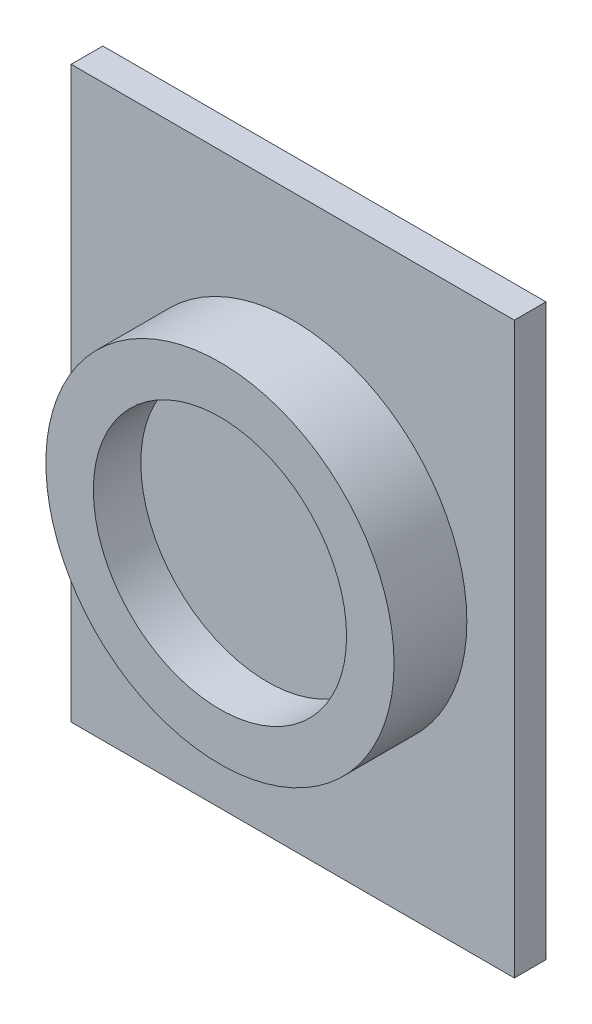
from build123d import *

# Parameters (mm, degrees)
CROQUIS1_W              = 140
CROQUIS1_H              = 180
SALIENTE_EXTRUIR1_DEPTH = 10
CROQUIS2_R              = 55
SALIENTE_EXTRUIR2_DEPTH = 8
CROQUIS3_R              = 55
CROQUIS3_R_2            = 40
SALIENTE_EXTRUIR3_DEPTH = 15


with BuildPart() as part:
    # Croquis1 → Saliente-Extruir1 (new body)
    with BuildSketch(Plane.XY):
        with Locations((70, 90)):
            Rectangle(CROQUIS1_W, CROQUIS1_H)
    extrude(amount=SALIENTE_EXTRUIR1_DEPTH)

    # Croquis2 → Saliente-Extruir2 (add)
    with BuildSketch(Plane.XY.offset(10)):
        with Locations((70, 90)):
            Circle(CROQUIS2_R)
    extrude(amount=SALIENTE_EXTRUIR2_DEPTH)

    # Croquis3 → Saliente-Extruir3 (add)
    with BuildSketch(Plane.XY.offset(18)):
        with Locations((70, 90)):
            Circle(CROQUIS3_R)
        with Locations((70, 90)):
            Circle(CROQUIS3_R_2, mode=Mode.SUBTRACT)
    extrude(amount=SALIENTE_EXTRUIR3_DEPTH)


solid = part.part
